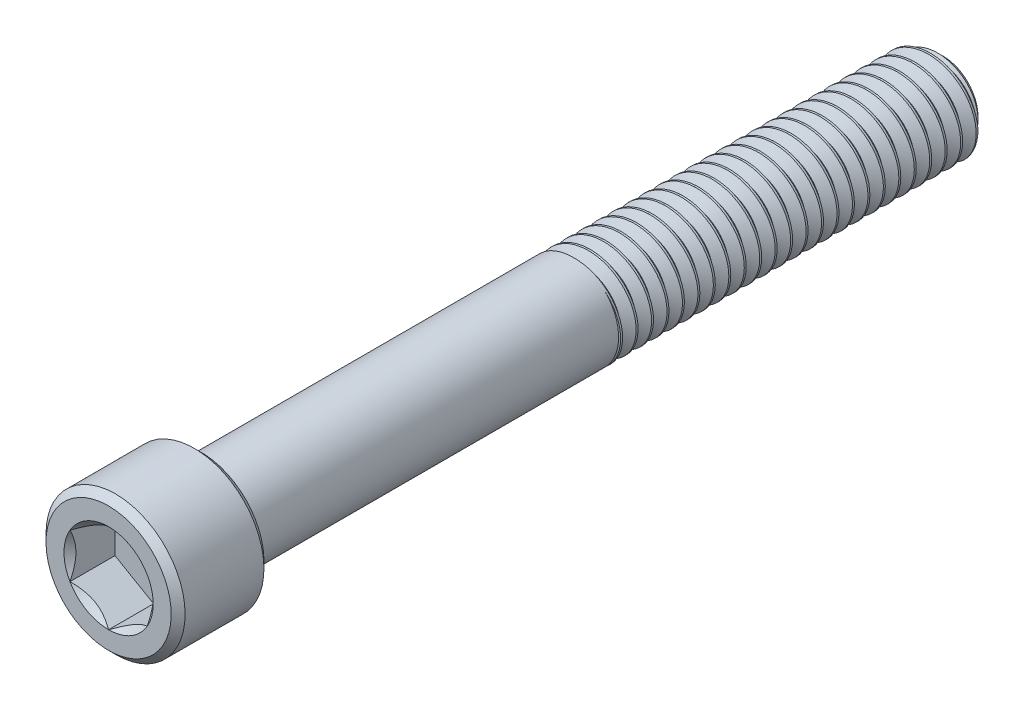
from build123d import *

# Parameters (mm, degrees)
CUT_EXTRUDE1_DEPTH  = 4.6228
CHAMFER1_SIZE       = 0.714375
CUT_SWEEP1_PITCH    = 1.5875
CUT_SWEEP1_TO       = 76.2
SKETCH8_R           = 5.159375
BOSS_EXTRUDE1_DEPTH = 2.54
BOSS_EXTRUDE1_TAPER = 60
SKETCH9_R           = 4.7625
BOSS_EXTRUDE2_DEPTH = 38.1


with BuildPart() as part:
    # Sketch3 → Revolve1 (revolve)
    with BuildSketch(Plane(origin=(0, 0, 0), x_dir=(0, 0, -1), z_dir=(1, 0, 0)), mode=Mode.PRIVATE) as revolve1_sk:
        Polygon((-42.8625, 7.14375), (-42.8625, 3.96875), (-38.2397, 3.96875), (-38.2397, 0), (42.8625, 0), (42.8625, 3.571875), (41.671875, 4.7625), (-33.3375, 4.7625), (-33.3375, 7.14375), align=None)
    revolve(revolve1_sk.sketch.rotate(Axis((0, 0, 42.8625), (0, 0, -1)), 180), axis=Axis((0, 0, 42.8625), (0, 0, -1)))

    # Sketch4 → Cut-Extrude1 (cut)
    with BuildSketch(Plane.XY.offset(42.8625)):
        Polygon((0, 4.582717762), (-3.96875, 2.291358881), (-3.96875, -2.291358881), (0, -4.582717762), (3.96875, -2.291358881), (3.96875, 2.291358881), align=None)
    extrude(amount=-CUT_EXTRUDE1_DEPTH, mode=Mode.SUBTRACT)

    # Cut-Extrude2 cone 1 section (through the dimple's axis) → Cut-Extrude2 (revolve, cut)
    with BuildSketch(Plane(origin=(0, 0, 42.8625), x_dir=(0, -1, 0), z_dir=(1, 0, 0))):
        Polygon((0, 0), (4.582717762, 0), (0, 4.582717762), align=None)
    revolve(axis=Axis((0, 0, 42.8625), (0, 0, -1)), mode=Mode.SUBTRACT)

    # Chamfer1
    chamfer1_edges = [part.edges().sort_by_distance(p)[0] for p in [
        (0, 7.14375, 42.8625),
        (0, 7.14375, 33.3375),
    ]]
    chamfer(chamfer1_edges, length=CHAMFER1_SIZE)


with BuildPart() as body_2:
    # Split1: read off the stored shape, not the designer's step
    # Split1: the piece on the far side of the plane
    add(part.part)
    split(bisect_by=Plane.XY.offset(33.3375), keep=Keep.BOTTOM)

    # Cut-Sweep1: arcs per turn and ends read off the stored shape
    # Cut-Sweep1: the profile of Sketch7 screwed along a right-hand helix through 49 turns, 8 arcs to a turn; built about Z, then put on its axis
    cut_sweep1_z = Axis((0, 0, 0), (0, 0, 1))
    cut_sweep1_corners = [(3.731388504, 0, -0.5953125), (3.731388504, 0, -0.79375), (4.848425958, 0, -1.438671875), (4.848425958, 0, 0.049609375)]
    with BuildLine(mode=Mode.PRIVATE) as cut_sweep1_profile:
        Line(cut_sweep1_corners[0], cut_sweep1_corners[1])
        Line(cut_sweep1_corners[1], cut_sweep1_corners[2])
        Line(cut_sweep1_corners[2], cut_sweep1_corners[3])
        Line(cut_sweep1_corners[3], cut_sweep1_corners[0])
    cut_sweep1_cap = Face(cut_sweep1_profile.wire())
    cut_sweep1_turn_angles = [0, 22.5, 45, 67.5, 90, 112.5, 135, 157.5, 180, 202.5, 225, 247.5, 270, 292.5, 315, 337.5, 360]
    cut_sweep1_turn_weights = [1, 0.9238795325112867, 1, 0.9238795325112867, 1, 0.9238795325112867, 1, 0.9238795325112867, 1, 0.9238795325112867, 1, 0.9238795325112867, 1, 0.9238795325112867, 1, 0.9238795325112867, 1]
    cut_sweep1_turn_rails = [Edge.make_bspline([Vector(p[0], p[1], 0).rotate(cut_sweep1_z, cut_sweep1_turn_angles[k]) / cut_sweep1_turn_weights[k] + Vector(0, 0, p[2] + CUT_SWEEP1_PITCH * cut_sweep1_turn_angles[k] / 360) for k in range(17)], [0, 0, 0, 1, 1, 2, 2, 3, 3, 4, 4, 5, 5, 6, 6, 7, 7, 8, 8, 8], 2, cut_sweep1_turn_weights) for p in cut_sweep1_corners]
    cut_sweep1_turn_sides = [Face.make_surface_from_curves(cut_sweep1_turn_rails[p[0]], cut_sweep1_turn_rails[p[1]]) for p in [(0, 1), (1, 2), (2, 3), (3, 0)]]
    cut_sweep1 = Plane(origin=(0, 0, -42.8625), x_dir=(0, 1, 0), z_dir=(0, 0, 1)) * split(Solid(Shell([*[p.moved(Location((0, 0, CUT_SWEEP1_PITCH * i))) for i in range(49) for p in cut_sweep1_turn_sides], cut_sweep1_cap, cut_sweep1_cap.rotate(cut_sweep1_z, 17640).moved(Location((0, 0, CUT_SWEEP1_PITCH * 17640 / 360)))])), bisect_by=Plane.XY.offset(CUT_SWEEP1_TO), keep=Keep.BOTTOM, mode=Mode.PRIVATE)
    add(cut_sweep1, mode=Mode.SUBTRACT)


with BuildPart() as part_1:
    add(part.part)

    # Split1
    split(bisect_by=Plane.XY.offset(33.3375), keep=Keep.TOP)

    add(body_2.part)  # Boss-Extrude1 merges body 2
    # Sketch8 → Boss-Extrude1 (add)
    with BuildSketch(Plane(origin=(0, 0, 33.3375), x_dir=(-1, 0, 0), z_dir=(0, 0, -1))):
        Circle(SKETCH8_R)
    extrude(amount=BOSS_EXTRUDE1_DEPTH, taper=BOSS_EXTRUDE1_TAPER)

    # Sketch9 → Boss-Extrude2 (add)
    with BuildSketch(Plane(origin=(0, 0, 33.3375), x_dir=(-1, 0, 0), z_dir=(0, 0, -1))):
        with Locations(Location((0, 0, 0), (0, 0, 90))):
            Circle(SKETCH9_R)
    extrude(amount=BOSS_EXTRUDE2_DEPTH)


solid = part_1.part
